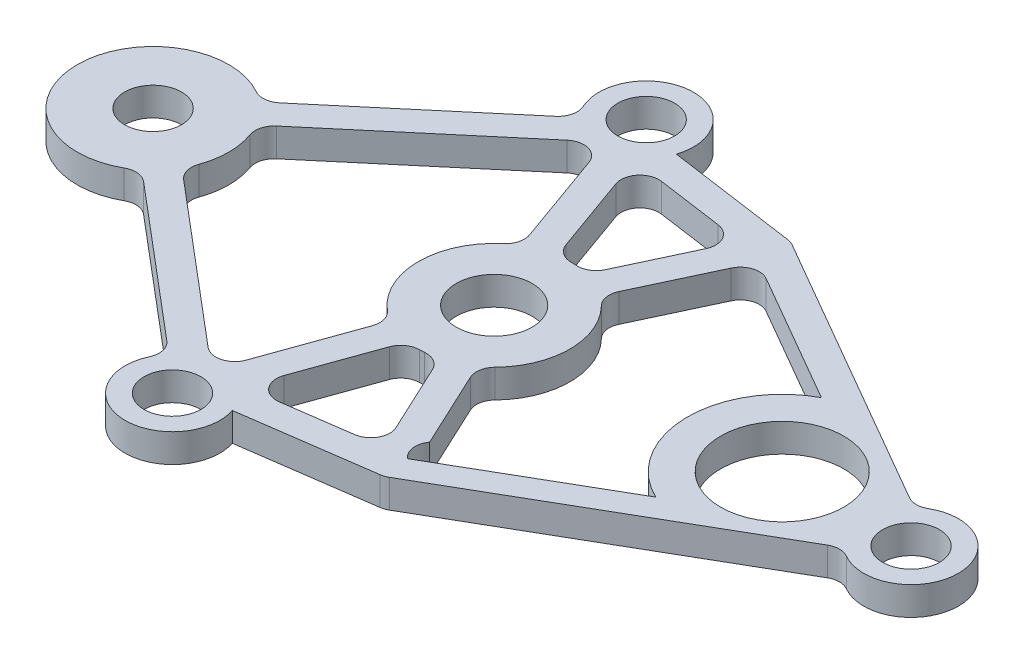
from build123d import *

# Parameters (mm, degrees)
SKETCH_1_R      = 1.5
SKETCH_1_R_2    = 3.25
EXTRUDE_1_DEPTH = 1.5


with BuildPart() as part:
    # 草图1 → 凸台-拉伸1 (new body)
    with BuildSketch(Plane(origin=(0, 0, 0), x_dir=(1, 0, 0), z_dir=(0, 1, 0))):
        with BuildLine():
            ThreePointArc((20.75, 2.165063509), (20.25, 2.031088913), (19.75, 2.165063509))
            Line((19.75, 2.165063509), (5.096488448, 10.625272348))
            ThreePointArc((5.096488448, 10.625272348), (4.922427124, 10.704637858), (4.736437674, 10.749405626))
            Line((4.736437674, 10.749405626), (-2.101908222, 11.7159388))
            ThreePointArc((-2.101908222, 11.7159388), (-4.61878361, 14.995906411), (-6.744553684, 11.449929699))
            ThreePointArc((-6.744553684, 11.449929699), (-6.675732942, 10.813623622), (-7.006838923, 10.265909693))
            Line((-7.006838923, 10.265909693), (-14.905573539, 3.595069524))
            ThreePointArc((-14.905573539, 3.595069524), (-15.456234647, 3.363542696), (-16.040639512, 3.487249128))
            ThreePointArc((-16.040639512, 3.487249128), (-22, 0), (-16.040639512, -3.487249128))
            ThreePointArc((-16.040639512, -3.487249128), (-15.456234647, -3.363542696), (-14.905573539, -3.595069524))
            Line((-14.905573539, -3.595069524), (-7.006838923, -10.265909693))
            ThreePointArc((-7.006838923, -10.265909693), (-6.675732942, -10.813623622), (-6.744553684, -11.449929699))
            ThreePointArc((-6.744553684, -11.449929699), (-4.61878361, -14.995906411), (-2.101908222, -11.7159388))
            Line((-2.101908222, -11.7159388), (4.736437674, -10.749405626))
            ThreePointArc((4.736437674, -10.749405626), (4.922427124, -10.704637858), (5.096488448, -10.625272348))
            Line((5.096488448, -10.625272348), (19.75, -2.165063509))
            ThreePointArc((19.75, -2.165063509), (20.25, -2.031088913), (20.75, -2.165063509))
            ThreePointArc((20.75, -2.165063509), (24.5, 0), (20.75, 2.165063509))
        make_face()
        with Locations((-4.47577596, -12.5)):
            Circle(SKETCH_1_R, mode=Mode.SUBTRACT)
        with BuildLine():
            ThreePointArc((-1.256530939, -10.081544307), (-2.171731289, -9.72303877), (-2.33794765, -8.754281823))
            Line((-2.33794765, -8.754281823), (-0.872808817, -4.662424773))
            ThreePointArc((-0.872808817, -4.662424773), (-0.512657064, -4.185850496), (0.054926934, -3.999622861))
            ThreePointArc((0.054926934, -3.999622861), (0.187612888, -3.995597753), (0.320092213, -3.987172052))
            ThreePointArc((0.320092213, -3.987172052), (0.902629068, -4.119395878), (1.305852753, -4.56012594))
            Line((1.305852753, -4.56012594), (2.997222742, -8.174556771))
            ThreePointArc((2.997222742, -8.174556771), (2.970810351, -9.074617878), (2.23143448, -9.588554578))
            Line((2.23143448, -9.588554578), (-1.256530939, -10.081544307))
        make_face(mode=Mode.SUBTRACT)
        with BuildLine():
            Line((-13.937734763, 2.449081695), (-5.622052564, 9.472053038))
            ThreePointArc((-5.622052564, 9.472053038), (-4.717022681, 9.673722513), (-4.035359228, 9.045164955))
            Line((-4.035359228, 9.045164955), (-2.285010045, 4.156769069))
            ThreePointArc((-2.285010045, 4.156769069), (-2.260804326, 3.559905256), (-2.581182025, 3.055732213))
            ThreePointArc((-2.581182025, 3.055732213), (-4, 0), (-2.581182025, -3.055732213))
            ThreePointArc((-2.581182025, -3.055732213), (-2.260804326, -3.559905256), (-2.285010045, -4.156769069))
            Line((-2.285010045, -4.156769069), (-4.035359228, -9.045164955))
            ThreePointArc((-4.035359228, -9.045164955), (-4.717022681, -9.673722513), (-5.622052564, -9.472053038))
            Line((-5.622052564, -9.472053038), (-13.937734763, -2.449081695))
            ThreePointArc((-13.937734763, -2.449081695), (-14.258158429, -1.944937864), (-14.23400713, -1.348071847))
            ThreePointArc((-14.23400713, -1.348071847), (-14, 0), (-14.23400713, 1.348071847))
            ThreePointArc((-14.23400713, 1.348071847), (-14.258158429, 1.944937864), (-13.937734763, 2.449081695))
        make_face(mode=Mode.SUBTRACT)
        with BuildLine():
            Line((5.956182941, 8.396876694), (12.853062501, 4.414961424))
            ThreePointArc((12.853062501, 4.414961424), (10.200941154, -0.097008541), (13.026112738, -4.50268966))
            Line((13.026112738, -4.50268966), (4.721405489, -9.297414626))
            ThreePointArc((4.721405489, -9.297414626), (4.374221674, -8.659373504), (4.550445454, -7.954690416))
            Line((4.550445454, -7.954690416), (2.664458984, -3.924367251))
            ThreePointArc((2.664458984, -3.924367251), (2.584431714, -3.332397688), (2.856157177, -2.800422501))
            ThreePointArc((2.856157177, -2.800422501), (4, 0), (2.856157177, 2.800422501))
            ThreePointArc((2.856157177, 2.800422501), (2.584431714, 3.332397688), (2.664458984, 3.924367251))
            Line((2.664458984, 3.924367251), (4.550445454, 7.954690416))
            ThreePointArc((4.550445454, 7.954690416), (5.156119776, 8.484770625), (5.956182941, 8.396876694))
        make_face(mode=Mode.SUBTRACT)
        with Locations((-18, 0)):
            Circle(SKETCH_1_R, mode=Mode.SUBTRACT)
        with BuildLine():
            ThreePointArc((2, 0), (1.451384048, -1.376039369), (0.106515655, -1.99716159))
            ThreePointArc((0.106515655, -1.99716159), (0.093806444, -1.997798877), (0.081093436, -1.998355287))
            ThreePointArc((0.081093436, -1.998355287), (-1.442599541, 1.38524603), (2, 0))
        make_face(mode=Mode.SUBTRACT)
        with BuildLine():
            Line((-1.256530939, 10.081544307), (2.23143448, 9.588554578))
            ThreePointArc((2.23143448, 9.588554578), (2.970810351, 9.074617878), (2.997222742, 8.174556771))
            Line((2.997222742, 8.174556771), (1.305852753, 4.56012594))
            ThreePointArc((1.305852753, 4.56012594), (0.902629068, 4.119395878), (0.320092213, 3.987172052))
            ThreePointArc((0.320092213, 3.987172052), (0.187612888, 3.995597753), (0.054926934, 3.999622861))
            ThreePointArc((0.054926934, 3.999622861), (-0.512657064, 4.185850496), (-0.872808817, 4.662424773))
            Line((-0.872808817, 4.662424773), (-2.33794765, 8.754281823))
            ThreePointArc((-2.33794765, 8.754281823), (-2.171731289, 9.72303877), (-1.256530939, 10.081544307))
        make_face(mode=Mode.SUBTRACT)
        with Locations((-4.47577596, 12.5)):
            Circle(SKETCH_1_R, mode=Mode.SUBTRACT)
        with Locations((15.2, 0)):
            Circle(SKETCH_1_R_2, mode=Mode.SUBTRACT)
        with Locations((22, 0)):
            Circle(SKETCH_1_R, mode=Mode.SUBTRACT)
    extrude(amount=EXTRUDE_1_DEPTH)


solid = part.part
